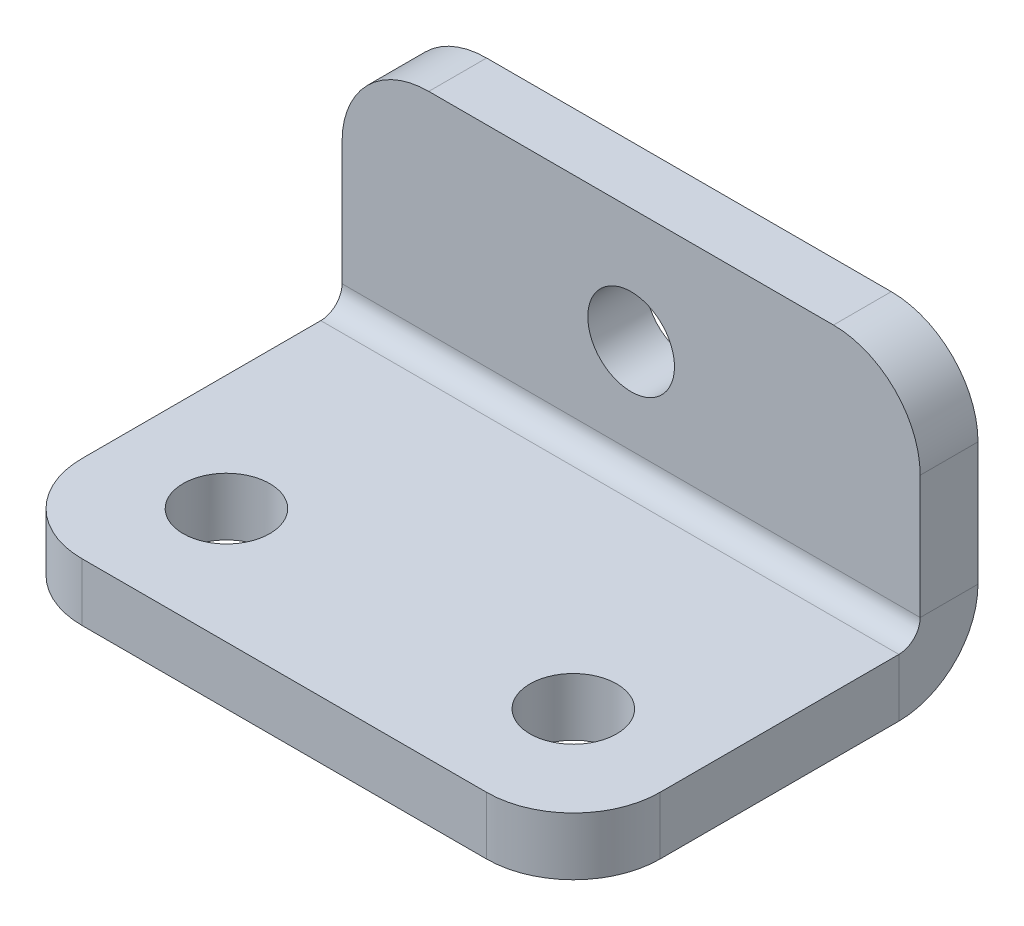
from build123d import *

# Parameters (mm, degrees)
TABAN_FLAN_1_DEPTH    = 20
RADYUS1_R             = 3
IZIM6_R               = 1.5
KES_EKSTR_ZYON1_DEPTH = 10
IZIM7_R               = 1.5
KES_EKSTR_ZYON2_DEPTH = 10


# Sheet-metal steps are written as plain solids
with BuildPart() as part:
    # Çizim1 → Taban-Flanş1 (new body)
    with BuildSketch(Plane(origin=(0, 0, 0), x_dir=(0, 0, -1), z_dir=(1, 0, 0))):
        with BuildLine():
            Line((-12, 0), (-0.7366, 0))
            ThreePointArc((-0.7366, 0), (-0.215745145, 0.215745145), (0, 0.7366))
            Line((0, 0.7366), (0, 8))
            Line((0, 8), (2, 8))
            Line((2, 8), (2, 0.7366))
            ThreePointArc((2, 0.7366), (1.198468417, -1.198468417), (-0.7366, -2))
            Line((-0.7366, -2), (-12, -2))
            Line((-12, -2), (-12, 0))
        make_face()
    extrude(amount=TABAN_FLAN_1_DEPTH)

    # Radyus1
    radyus1_edges = [part.edges().sort_by_distance(p)[0] for p in [
        (20, 8, -1),
        (0, 8, -1),
        (20, -1, 12),
        (0, -1, 12),
    ]]
    fillet(radyus1_edges, radius=RADYUS1_R)

    # Çizim6 → Kes-Ekstrüzyon1 (cut)
    with BuildSketch(Plane.XY):
        with Locations((10, 4)):
            Circle(IZIM6_R)
    extrude(amount=-KES_EKSTR_ZYON1_DEPTH, mode=Mode.SUBTRACT)

    # Çizim7 → Kes-Ekstrüzyon2 (cut)
    with BuildSketch(Plane(origin=(0, 0, 0), x_dir=(1, 0, 0), z_dir=(0, 1, 0))):
        with Locations(Location((4, -8, 0), (0, 0, 270))):
            Circle(IZIM7_R)
        with Locations(Location((16, -8, 0), (0, 0, 90))):
            Circle(IZIM7_R)
    extrude(amount=-KES_EKSTR_ZYON2_DEPTH, mode=Mode.SUBTRACT)


solid = part.part
